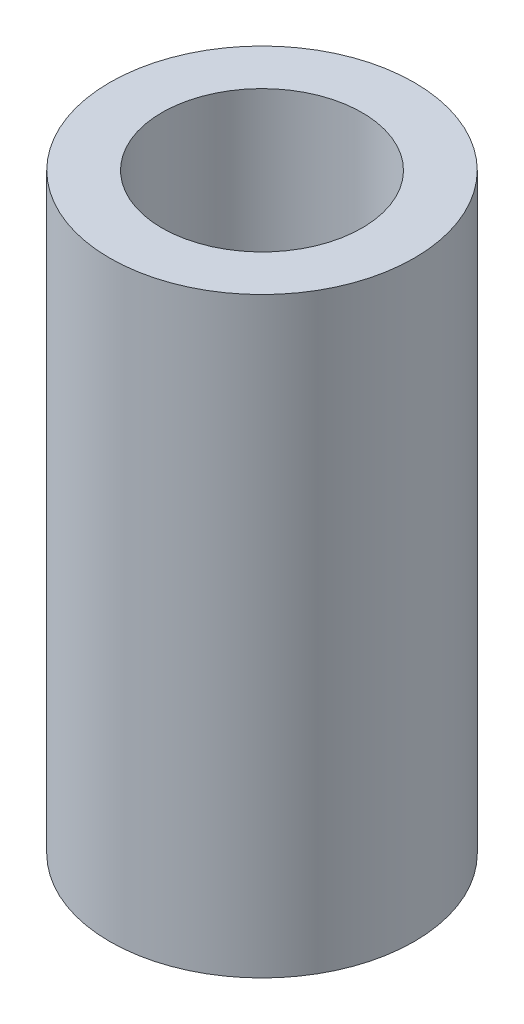
from build123d import *

# Parameters (mm, degrees)
SKETCH2_R      = 44.831
SKETCH2_R_2    = 29.472535649
EXTRUDE1_DEPTH = 174.333333324


with BuildPart() as part:
    # Sketch2 → Extrude1 (new body)
    with BuildSketch(Plane(origin=(0, 0, 0), x_dir=(1, 0, 0), z_dir=(0, 1, 0))):
        Circle(SKETCH2_R)
        Circle(SKETCH2_R_2, mode=Mode.SUBTRACT)
    extrude(amount=EXTRUDE1_DEPTH)


solid = part.part
